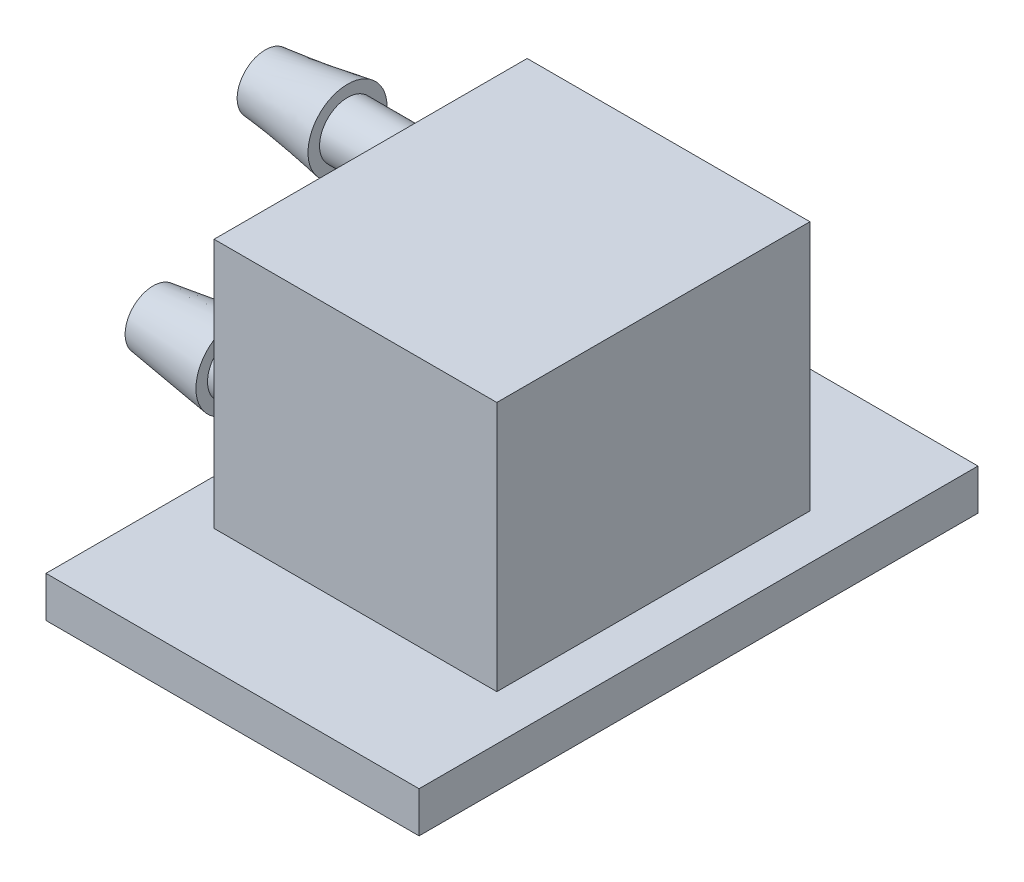
from build123d import *

# Parameters (mm, degrees)
SKETCH1_W           = 10.8966
SKETCH1_H           = 12.065
BOSS_EXTRUDE1_DEPTH = 9.652
SKETCH2_R           = 1.0795
BOSS_EXTRUDE2_DEPTH = 3.048
SKETCH6_R           = 1.524
SKETCH7_R           = 1.0795
SKETCH8_W           = 14.3764
SKETCH8_H           = 21.5392
BOSS_EXTRUDE3_DEPTH = 1.5748


with BuildPart() as part:
    # Sketch1 → Boss-Extrude1 (new body)
    with BuildSketch(Plane(origin=(0, 0, 0), x_dir=(1, 0, 0), z_dir=(0, 1, 0))):
        with Locations((5.4483, 6.0325)):
            Rectangle(SKETCH1_W, SKETCH1_H)
    extrude(amount=BOSS_EXTRUDE1_DEPTH)

    # Sketch2 → Boss-Extrude2 (add)
    with BuildSketch(Plane.ZY):
        with Locations(Location((-8.1915, 7.6835, 0), (0, 0, 180))):
            Circle(SKETCH2_R)
        with Locations(Location((-3.8735, 1.9685, 0), (0, 0, 180))):
            Circle(SKETCH2_R)
    extrude(amount=BOSS_EXTRUDE2_DEPTH)

    # Loft1: read off the stored shape, not the designer's step
    # Loft1: loft between two sections, ruled curve by curve
    loft1_from = [
        Edge.make_bspline([(-3.048, 9.153232542, -7.788433932), (-3.048, 9.959364678, -10.727899016), (-3.048, 7.019899594, -11.534031152), (-3.048, 6.213767458, -8.594566068), (-3.048, 5.407635322, -5.655100984), (-3.048, 8.347100406, -4.848968848), (-3.048, 9.153232542, -7.788433932)], [0, 0, 0, 0, 0.5, 0.5, 0.5, 1, 1, 1, 1], 3, [1, 0.333333333, 0.333333333, 1, 0.333333333, 0.333333333, 1]),
    ]
    loft1_to = [
        Edge.make_bspline([(-6.223, 8.482388093, -7.465484805), (-6.223, 9.934418484, -9.063260992), (-6.223, 8.336642297, -10.515291382), (-6.223, 6.884611907, -8.917515195), (-6.223, 5.432581516, -7.319739008), (-6.223, 7.030357703, -5.867708618), (-6.223, 8.482388093, -7.465484805)], [0, 0, 0, 0, 0.5, 0.5, 0.5, 1, 1, 1, 1], 3, [1, 0.333333333, 0.333333333, 1, 0.333333333, 0.333333333, 1]),
    ]
    loft1 = Solid(Shell([*[Face.make_surface_from_curves(loft1_from[k], loft1_to[k]) for k in range(1)], Face(Wire(loft1_from)), Face(Wire(loft1_to))]))
    add(loft1)

    # Sketch6 → Loft2 section 0
    with BuildSketch(Plane.ZY.offset(3.048)):
        with Locations((-3.8735, 1.9685)):
            Circle(SKETCH6_R)
    # Sketch7 → Loft2 section 1
    with BuildSketch(Plane.ZY.offset(6.223)):
        with Locations((-3.8735, 1.9685)):
            Circle(SKETCH7_R)
    loft()

    # Sketch8 → Boss-Extrude3 (add)
    with BuildSketch(Plane.XZ):
        with Locations((5.4483, -6.0325)):
            Rectangle(SKETCH8_W, SKETCH8_H)
    extrude(amount=BOSS_EXTRUDE3_DEPTH)


solid = part.part
